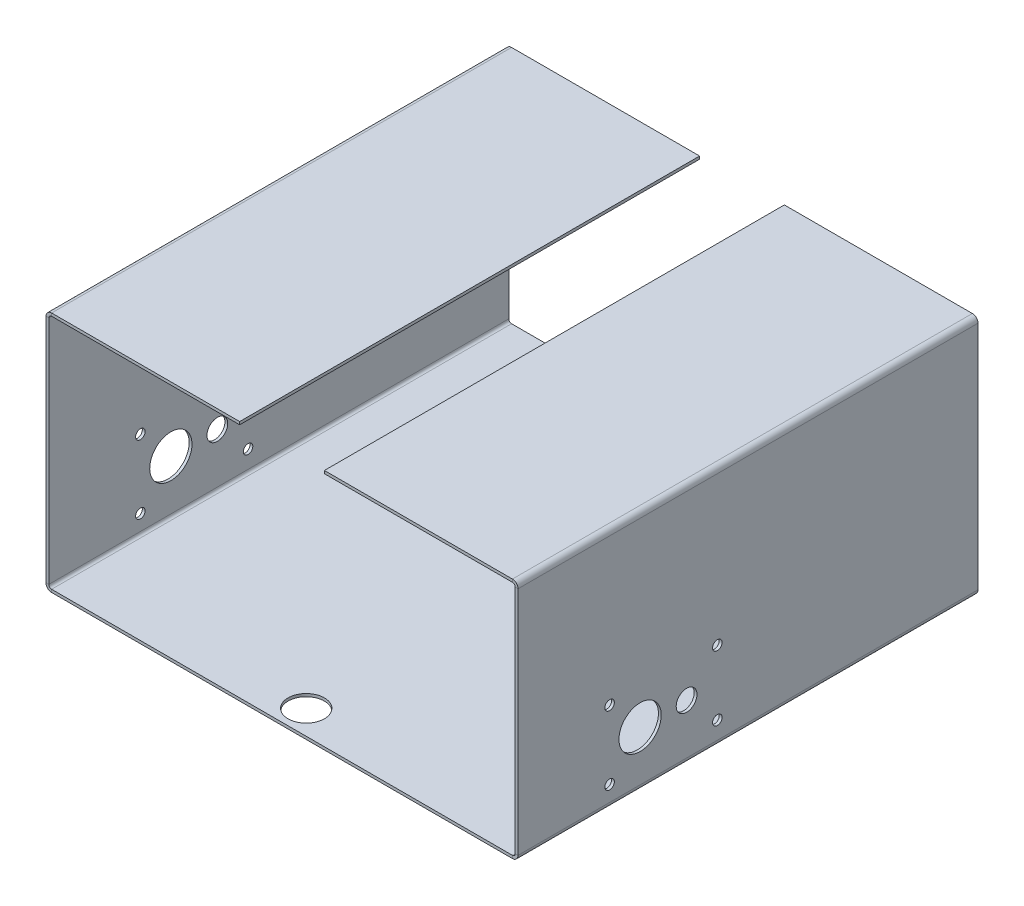
from build123d import *

# Parameters (mm, degrees)
SKETCH1_W                      = 123.825
SKETCH1_H                      = 120.65
BASE_FLANGE1_DEPTH             = 0.7366
EDGE_FLANGE1_STRIP_W           = 4.4196
EDGE_FLANGE1_STRIP_H           = 0.7366
EDGE_FLANGE1_STRIP_CUT_DEPTH   = 120.65
EDGE_FLANGE1_STRIP_2_W         = 4.4196
EDGE_FLANGE1_STRIP_2_H         = 0.7366
EDGE_FLANGE1_STRIP_CUT_2_DEPTH = 120.65
EDGE_FLANGE1_DEPTH             = 120.65
EDGE_FLANGE1_BEND_DEPTH        = 120.65
EDGE_FLANGE2_STRIP_W           = 4.4196
EDGE_FLANGE2_STRIP_H           = 0.7366
EDGE_FLANGE2_STRIP_CUT_DEPTH   = 120.65
EDGE_FLANGE2_DEPTH             = 120.65
EDGE_FLANGE3_STRIP_W           = 4.4196
EDGE_FLANGE3_STRIP_H           = 0.7366
EDGE_FLANGE3_STRIP_CUT_DEPTH   = 120.65
EDGE_FLANGE3_DEPTH             = 120.65
F_4_CLEARANCE_HOLE1_D          = 2.4892
SKETCH28_R                     = 5.54355
SKETCH28_R_2                   = 2.72415
CUT_EXTRUDE1_DEPTH             = 221.859453756
UNFOLD1_OUTLINE_W              = 50.8
UNFOLD1_OUTLINE_H              = 120.65
UNFOLD1_DEPTH                  = 62.7634
UNFOLD1_START                  = -0.7366
UNFOLD1_2_OUTLINE_W            = 162.678345723
UNFOLD1_2_OUTLINE_H            = 120.65
UNFOLD1_2_OUTLINE_R            = 1.2446
UNFOLD1_2_OUTLINE_R_2          = 5.54355
UNFOLD1_2_OUTLINE_R_3          = 2.72415
UNFOLD1_2_DEPTH                = 0.7366
SKETCH30_R                     = 4.7625
CUT_EXTRUDE2_DEPTH             = 1.27
FOLD1_START                    = -111.878345723
FOLD1_OUTLINE_W                = 0.7366
FOLD1_OUTLINE_H                = 120.65
FOLD1_DEPTH                    = 112.029702291
FOLD1_START_2                  = 123.673643432
FOLD1_2_OUTLINE_W              = 0.7366
FOLD1_2_OUTLINE_H              = 120.65
FOLD1_2_DEPTH                  = 112.029702291
FOLD1_START_3                  = 1.4732
FOLD1_3_OUTLINE_W              = 0.7366
FOLD1_3_OUTLINE_H              = 120.65
FOLD1_3_DEPTH                  = 49.3268
FOLD1_START_4                  = 73.025
FOLD1_4_OUTLINE_W              = 0.7366
FOLD1_4_OUTLINE_H              = 120.65
FOLD1_4_DEPTH                  = 49.3268
FOLD1_START_5                  = 0.732563432
FOLD1_5_OUTLINE_W              = 62.0268
FOLD1_5_OUTLINE_H              = 120.65
FOLD1_5_OUTLINE_R              = 1.2446
FOLD1_5_OUTLINE_R_2            = 2.72415
FOLD1_5_OUTLINE_R_3            = 5.54355
FOLD1_5_DEPTH                  = 0.004036568
FOLD1_START_6                  = 123.0884
FOLD1_6_OUTLINE_W              = 62.0268
FOLD1_6_OUTLINE_H              = 120.65
FOLD1_6_OUTLINE_R              = 1.2446
FOLD1_6_OUTLINE_R_2            = 2.72415
FOLD1_6_OUTLINE_R_3            = 5.54355
FOLD1_6_DEPTH                  = 0.004036568
FOLD1_7_OUTLINE_W              = 62.0268
FOLD1_7_OUTLINE_H              = 120.65
FOLD1_7_OUTLINE_R              = 1.2446
FOLD1_7_OUTLINE_R_2            = 2.72415
FOLD1_7_OUTLINE_R_3            = 5.54355
FOLD1_7_DEPTH                  = 1.4732
FOLD1_START_7                  = 122.3518
FOLD1_8_OUTLINE_W              = 62.0268
FOLD1_8_OUTLINE_H              = 120.65
FOLD1_8_OUTLINE_R              = 1.2446
FOLD1_8_OUTLINE_R_2            = 2.72415
FOLD1_8_OUTLINE_R_3            = 5.54355
FOLD1_8_DEPTH                  = 1.4732
FOLD1_START_8                  = -120.65
FOLD1_9_DEPTH                  = 120.65
FOLD1_10_DEPTH                 = 120.65


with BuildPart() as part:
    # Base-Flange1: sheet metal written as solids
    # Sketch1 → Base-Flange1 (new body)
    with BuildSketch(Plane(origin=(0, 0, 0), x_dir=(1, 0, 0), z_dir=(0, 1, 0))):
        with Locations((61.9125, 60.325)):
            Rectangle(SKETCH1_W, SKETCH1_H)
    extrude(amount=-BASE_FLANGE1_DEPTH)

    # Edge-Flange1: sheet metal written as solids
    # Edge-Flange1 strip (on a plane across the edge) → Edge-Flange1 strip cut (cut)
    with BuildSketch(Plane(origin=(123.825, 0, 0), x_dir=(-1, 0, 0), z_dir=(0, 0, -1))):
        with Locations((-0.7366, -0.3683)):
            Rectangle(EDGE_FLANGE1_STRIP_W, EDGE_FLANGE1_STRIP_H)
    extrude(amount=EDGE_FLANGE1_STRIP_CUT_DEPTH, mode=Mode.SUBTRACT)

    # Edge-Flange1 strip 2 (on a plane across the edge) → Edge-Flange1 strip cut 2 (cut)
    with BuildSketch(Plane.XY.offset(-120.65)):
        with Locations((-0.7366, -0.3683)):
            Rectangle(EDGE_FLANGE1_STRIP_2_W, EDGE_FLANGE1_STRIP_2_H)
    extrude(amount=EDGE_FLANGE1_STRIP_CUT_2_DEPTH, mode=Mode.SUBTRACT)

    # Edge-Flange1 section (on a plane across the edge) → Edge-Flange1 (add)
    with BuildSketch(Plane(origin=(123.825, 0, 0), x_dir=(-1, 0, 0), z_dir=(0, 0, -1))):
        with BuildLine():
            Line((0, 0.7366), (0, 62.7634))
            Line((0, 62.7634), (0.7366, 62.7634))
            Line((0.7366, 62.7634), (0.7366, 0.7366))
            ThreePointArc((0.7366, 0.7366), (0.952345145, 0.215745145), (1.4732, 0))
            Line((1.4732, 0), (1.4732, -0.7366))
            ThreePointArc((1.4732, -0.7366), (0.43149029, -0.30510971), (0, 0.7366))
        make_face()
    extrude(amount=EDGE_FLANGE1_DEPTH)

    # Edge-Flange1 section 2 (on a plane across the edge) → Edge-Flange1 bend (add)
    with BuildSketch(Plane.XY.offset(-120.65)):
        with BuildLine():
            Line((0, 0.7366), (0, 62.7634))
            Line((0, 62.7634), (0.7366, 62.7634))
            Line((0.7366, 62.7634), (0.7366, 0.7366))
            ThreePointArc((0.7366, 0.7366), (0.952345145, 0.215745145), (1.4732, 0))
            Line((1.4732, 0), (1.4732, -0.7366))
            ThreePointArc((1.4732, -0.7366), (0.43149029, -0.30510971), (0, 0.7366))
        make_face()
    extrude(amount=EDGE_FLANGE1_BEND_DEPTH)

    # Edge-Flange2: sheet metal written as solids
    # Edge-Flange2 strip (on a plane across the edge) → Edge-Flange2 strip cut (cut)
    with BuildSketch(Plane(origin=(123.0884, 62.7634, 0), x_dir=(0, -1, 0), z_dir=(0, 0, -1))):
        with Locations((-0.7366, -0.3683)):
            Rectangle(EDGE_FLANGE2_STRIP_W, EDGE_FLANGE2_STRIP_H)
    extrude(amount=EDGE_FLANGE2_STRIP_CUT_DEPTH, mode=Mode.SUBTRACT)

    # Edge-Flange2 section (on a plane across the edge) → Edge-Flange2 (add)
    with BuildSketch(Plane(origin=(123.0884, 62.7634, 0), x_dir=(0, -1, 0), z_dir=(0, 0, -1))):
        with BuildLine():
            Line((0, 0.7366), (0, 50.0634))
            Line((0, 50.0634), (0.7366, 50.0634))
            Line((0.7366, 50.0634), (0.7366, 0.7366))
            ThreePointArc((0.7366, 0.7366), (0.952345145, 0.215745145), (1.4732, 0))
            Line((1.4732, 0), (1.4732, -0.7366))
            ThreePointArc((1.4732, -0.7366), (0.43149029, -0.30510971), (0, 0.7366))
        make_face()
    extrude(amount=EDGE_FLANGE2_DEPTH)

    # Edge-Flange3: sheet metal written as solids
    # Edge-Flange3 strip (on a plane across the edge) → Edge-Flange3 strip cut (cut)
    with BuildSketch(Plane(origin=(0.7366, 62.7634, -120.65), x_dir=(0, -1, 0), z_dir=(0, 0, 1))):
        with Locations((-0.7366, -0.3683)):
            Rectangle(EDGE_FLANGE3_STRIP_W, EDGE_FLANGE3_STRIP_H)
    extrude(amount=EDGE_FLANGE3_STRIP_CUT_DEPTH, mode=Mode.SUBTRACT)

    # Edge-Flange3 section (on a plane across the edge) → Edge-Flange3 (add)
    with BuildSketch(Plane(origin=(0.7366, 62.7634, -120.65), x_dir=(0, -1, 0), z_dir=(0, 0, 1))):
        with BuildLine():
            Line((0, 0.7366), (0, 50.0634))
            Line((0, 50.0634), (0.7366, 50.0634))
            Line((0.7366, 50.0634), (0.7366, 0.7366))
            ThreePointArc((0.7366, 0.7366), (0.952345145, 0.215745145), (1.4732, 0))
            Line((1.4732, 0), (1.4732, -0.7366))
            ThreePointArc((1.4732, -0.7366), (0.43149029, -0.30510971), (0, 0.7366))
        make_face()
    extrude(amount=EDGE_FLANGE3_DEPTH)

    # #4 Clearance Hole1 (through all)
    with Locations(Plane(origin=(123.825, -24.718066827, -160.602803993), x_dir=(0, 0, -1), z_dir=(1, 0, 0))):
        with Locations((-136.587103993, 47.560286827), (-136.587103993, 29.561846827), (-108.337223993, 47.061176827), (-108.337223993, 30.060956827)):
            Hole(F_4_CLEARANCE_HOLE1_D / 2)

    # Sketch28 → Cut-Extrude1 (cut, through all)
    with BuildSketch(Plane(origin=(123.825, -24.718066827, -160.602803993), x_dir=(0, 0, -1), z_dir=(1, 0, 0))):
        with Locations(Location((-128.588643993, 38.561066827, 0), (0, 0, 90))):
            Circle(SKETCH28_R)
        with Locations(Location((-116.391563993, 38.561066827, 0), (0, 0, 90))):
            Circle(SKETCH28_R_2)
    extrude(amount=-CUT_EXTRUDE1_DEPTH, mode=Mode.SUBTRACT)

    # Unfold1: read off the stored shape, not the designer's step
    # Unfold1 outline → Unfold1 (cut)
    with BuildSketch(Plane(origin=(0, 0, 0), x_dir=(1, 0, 0), z_dir=(0, 1, 0))):
        with Locations((25.4, 60.325)):
            Rectangle(UNFOLD1_OUTLINE_W, UNFOLD1_OUTLINE_H)
        with Locations((98.425, 60.325)):
            Rectangle(UNFOLD1_OUTLINE_W, UNFOLD1_OUTLINE_H)
    extrude(amount=UNFOLD1_DEPTH, mode=Mode.SUBTRACT)

    # Unfold1 2 outline → Unfold1 2 (add)
    # profile 1 of 2: a face of its own
    with BuildSketch(Plane(origin=(0, 0, 0), x_dir=(1, 0, 0), z_dir=(0, 1, 0)).offset(UNFOLD1_START)):
        with Locations((-30.539172862, 60.325)):
            Rectangle(UNFOLD1_2_OUTLINE_W, UNFOLD1_2_OUTLINE_H)
        with Locations((-22.367992861, 24.0157)):
            Circle(UNFOLD1_2_OUTLINE_R, mode=Mode.SUBTRACT)
        with Locations((-4.369552861, 24.0157)):
            Circle(UNFOLD1_2_OUTLINE_R, mode=Mode.SUBTRACT)
        with Locations((-13.368772861, 32.01416)):
            Circle(UNFOLD1_2_OUTLINE_R_2, mode=Mode.SUBTRACT)
        with Locations((-13.368772861, 44.21124)):
            Circle(UNFOLD1_2_OUTLINE_R_3, mode=Mode.SUBTRACT)
        with Locations((-21.868882861, 52.26558)):
            Circle(UNFOLD1_2_OUTLINE_R, mode=Mode.SUBTRACT)
        with Locations((-4.868662861, 52.26558)):
            Circle(UNFOLD1_2_OUTLINE_R, mode=Mode.SUBTRACT)
    # profile 2 of 2: a face of its own
    with BuildSketch(Plane(origin=(0, 0, 0), x_dir=(1, 0, 0), z_dir=(0, 1, 0)).offset(UNFOLD1_START)):
        with Locations((154.364172862, 60.325)):
            Rectangle(UNFOLD1_2_OUTLINE_W, UNFOLD1_2_OUTLINE_H)
        with Locations((145.693882861, 52.26558)):
            Circle(UNFOLD1_2_OUTLINE_R, mode=Mode.SUBTRACT)
        with Locations((128.194552861, 24.0157)):
            Circle(UNFOLD1_2_OUTLINE_R, mode=Mode.SUBTRACT)
        with Locations((146.192992861, 24.0157)):
            Circle(UNFOLD1_2_OUTLINE_R, mode=Mode.SUBTRACT)
        with Locations((137.193772861, 32.01416)):
            Circle(UNFOLD1_2_OUTLINE_R_2, mode=Mode.SUBTRACT)
        with Locations((137.193772861, 44.21124)):
            Circle(UNFOLD1_2_OUTLINE_R_3, mode=Mode.SUBTRACT)
        with Locations((128.693662861, 52.26558)):
            Circle(UNFOLD1_2_OUTLINE_R, mode=Mode.SUBTRACT)
    extrude(amount=UNFOLD1_2_DEPTH)

    # Sketch30 → Cut-Extrude2 (cut)
    with BuildSketch(Plane(origin=(0, 0, 0), x_dir=(1, 0, 0), z_dir=(0, 1, 0))):
        with Locations(Location((61.9125, 114.3, 0), (0, 0, 270))):
            Circle(SKETCH30_R)
        with Locations(Location((61.9125, 6.35, 0), (0, 0, 270))):
            Circle(SKETCH30_R)
    extrude(amount=-CUT_EXTRUDE2_DEPTH, mode=Mode.SUBTRACT)

    # Fold1: read off the stored shape, not the designer's step
    # Fold1 outline → Fold1 (cut)
    with BuildSketch(Plane.YZ.offset(FOLD1_START)):
        with Locations((-0.3683, -60.325)):
            Rectangle(FOLD1_OUTLINE_W, FOLD1_OUTLINE_H)
    extrude(amount=FOLD1_DEPTH, mode=Mode.SUBTRACT)

    # Fold1 2 outline → Fold1 2 (cut)
    with BuildSketch(Plane.YZ.offset(FOLD1_START_2)):
        with Locations((-0.3683, -60.325)):
            Rectangle(FOLD1_2_OUTLINE_W, FOLD1_2_OUTLINE_H)
    extrude(amount=FOLD1_2_DEPTH, mode=Mode.SUBTRACT)

    # Fold1 5 outline → Fold1 5 (add)
    with BuildSketch(Plane.YZ.offset(FOLD1_START_5)):
        with Locations((31.0134, -60.325)):
            Rectangle(FOLD1_5_OUTLINE_W, FOLD1_5_OUTLINE_H)
        with Locations((5.34289, -52.26558)):
            Circle(FOLD1_5_OUTLINE_R, mode=Mode.SUBTRACT)
        with Locations((13.843, -44.21124)):
            Circle(FOLD1_5_OUTLINE_R_2, mode=Mode.SUBTRACT)
        with Locations((13.843, -32.01416)):
            Circle(FOLD1_5_OUTLINE_R_3, mode=Mode.SUBTRACT)
        with Locations((22.34311, -52.26558)):
            Circle(FOLD1_5_OUTLINE_R, mode=Mode.SUBTRACT)
        with Locations((4.84378, -24.0157)):
            Circle(FOLD1_5_OUTLINE_R, mode=Mode.SUBTRACT)
        with Locations((22.84222, -24.0157)):
            Circle(FOLD1_5_OUTLINE_R, mode=Mode.SUBTRACT)
    extrude(amount=FOLD1_5_DEPTH)

    # Fold1 6 outline → Fold1 6 (add)
    with BuildSketch(Plane.YZ.offset(FOLD1_START_6)):
        with Locations((31.0134, -60.325)):
            Rectangle(FOLD1_6_OUTLINE_W, FOLD1_6_OUTLINE_H)
        with Locations((5.34289, -52.26558)):
            Circle(FOLD1_6_OUTLINE_R, mode=Mode.SUBTRACT)
        with Locations((13.843, -44.21124)):
            Circle(FOLD1_6_OUTLINE_R_2, mode=Mode.SUBTRACT)
        with Locations((13.843, -32.01416)):
            Circle(FOLD1_6_OUTLINE_R_3, mode=Mode.SUBTRACT)
        with Locations((22.34311, -52.26558)):
            Circle(FOLD1_6_OUTLINE_R, mode=Mode.SUBTRACT)
        with Locations((4.84378, -24.0157)):
            Circle(FOLD1_6_OUTLINE_R, mode=Mode.SUBTRACT)
        with Locations((22.84222, -24.0157)):
            Circle(FOLD1_6_OUTLINE_R, mode=Mode.SUBTRACT)
    extrude(amount=FOLD1_6_DEPTH)



with BuildPart() as body_2:
    # Fold1 3 outline → Fold1 3 (new body)
    with BuildSketch(Plane.YZ.offset(FOLD1_START_3)):
        with Locations((62.3951, -60.325)):
            Rectangle(FOLD1_3_OUTLINE_W, FOLD1_3_OUTLINE_H)
    extrude(amount=FOLD1_3_DEPTH)


with BuildPart() as body_3:
    # Fold1 4 outline → Fold1 4 (new body)
    with BuildSketch(Plane.YZ.offset(FOLD1_START_4)):
        with Locations((62.3951, -60.325)):
            Rectangle(FOLD1_4_OUTLINE_W, FOLD1_4_OUTLINE_H)
    extrude(amount=FOLD1_4_DEPTH)


with BuildPart() as part_1:
    add(part.part)

    add(body_2.part)  # Fold1 7 merges body 2
    # Fold1 7 outline → Fold1 7 (add)
    with BuildSketch(Plane.YZ):
        with Locations((31.0134, -60.325)):
            Rectangle(FOLD1_7_OUTLINE_W, FOLD1_7_OUTLINE_H)
        with Locations((5.34289, -52.26558)):
            Circle(FOLD1_7_OUTLINE_R, mode=Mode.SUBTRACT)
        with Locations((13.843, -44.21124)):
            Circle(FOLD1_7_OUTLINE_R_2, mode=Mode.SUBTRACT)
        with Locations((13.843, -32.01416)):
            Circle(FOLD1_7_OUTLINE_R_3, mode=Mode.SUBTRACT)
        with Locations((22.34311, -52.26558)):
            Circle(FOLD1_7_OUTLINE_R, mode=Mode.SUBTRACT)
        with Locations((4.84378, -24.0157)):
            Circle(FOLD1_7_OUTLINE_R, mode=Mode.SUBTRACT)
        with Locations((22.84222, -24.0157)):
            Circle(FOLD1_7_OUTLINE_R, mode=Mode.SUBTRACT)
    extrude(amount=FOLD1_7_DEPTH)


    add(body_3.part)  # Fold1 8 merges body 3
    # Fold1 8 outline → Fold1 8 (add)
    with BuildSketch(Plane.YZ.offset(FOLD1_START_7)):
        with Locations((31.0134, -60.325)):
            Rectangle(FOLD1_8_OUTLINE_W, FOLD1_8_OUTLINE_H)
        with Locations((5.34289, -52.26558)):
            Circle(FOLD1_8_OUTLINE_R, mode=Mode.SUBTRACT)
        with Locations((13.843, -44.21124)):
            Circle(FOLD1_8_OUTLINE_R_2, mode=Mode.SUBTRACT)
        with Locations((13.843, -32.01416)):
            Circle(FOLD1_8_OUTLINE_R_3, mode=Mode.SUBTRACT)
        with Locations((22.34311, -52.26558)):
            Circle(FOLD1_8_OUTLINE_R, mode=Mode.SUBTRACT)
        with Locations((4.84378, -24.0157)):
            Circle(FOLD1_8_OUTLINE_R, mode=Mode.SUBTRACT)
        with Locations((22.84222, -24.0157)):
            Circle(FOLD1_8_OUTLINE_R, mode=Mode.SUBTRACT)
    extrude(amount=FOLD1_8_DEPTH)

    # Fold1 9 outline → Fold1 9 (cut)
    with BuildSketch(Plane.XY.offset(FOLD1_START_8)):
        with BuildLine():
            Line((0.151356568, -0.7366), (1.4732, -0.7366))
            ThreePointArc((1.4732, -0.7366), (0.43149029, -0.30510971), (0, 0.7366))
            Line((0, 0.7366), (0, 0))
            Line((0, 0), (0.151356568, 0))
            Line((0.151356568, 0), (0.151356568, -0.7366))
        make_face()
        with BuildLine():
            ThreePointArc((123.0884, 61.2902), (122.872654855, 61.811054855), (122.3518, 62.0268))
            Line((122.3518, 62.0268), (122.3518, 0))
            ThreePointArc((122.3518, 0), (122.872654855, 0.215745145), (123.0884, 0.7366))
            Line((123.0884, 0.7366), (123.0884, 61.2902))
        make_face()
        with BuildLine():
            ThreePointArc((123.627628625, 62.0268), (123.774801927, 61.671492217), (123.825, 61.2902))
            Line((123.825, 61.2902), (123.825, 62.0268))
            Line((123.825, 62.0268), (123.627628625, 62.0268))
        make_face()
        with BuildLine():
            ThreePointArc((123.825, 0.7366), (123.39350971, -0.30510971), (122.3518, -0.7366))
            Line((122.3518, -0.7366), (123.673643432, -0.7366))
            Line((123.673643432, -0.7366), (123.673643432, 0))
            Line((123.673643432, 0), (123.825, 0))
            Line((123.825, 0), (123.825, 0.7366))
        make_face()
        with BuildLine():
            Line((1.4732, 0), (1.4732, 62.0268))
            ThreePointArc((1.4732, 62.0268), (0.952345145, 61.811054855), (0.7366, 61.2902))
            Line((0.7366, 61.2902), (0.7366, 0.7366))
            ThreePointArc((0.7366, 0.7366), (0.952345145, 0.215745145), (1.4732, 0))
        make_face()
        with BuildLine():
            Line((0, 62.0268), (0, 61.2902))
            ThreePointArc((0, 61.2902), (0.050198073, 61.671492217), (0.197371375, 62.0268))
            Line((0.197371375, 62.0268), (0, 62.0268))
        make_face()
    extrude(amount=FOLD1_9_DEPTH, mode=Mode.SUBTRACT)

    # Fold1 10 outline → Fold1 10 (add)
    with BuildSketch(Plane.XY.offset(FOLD1_START_8)):
        with BuildLine():
            Line((122.3518, 62.0268), (123.627628625, 62.0268))
            ThreePointArc((123.627628625, 62.0268), (123.0884, 62.566028625), (122.3518, 62.7634))
            Line((122.3518, 62.7634), (122.3518, 62.0268))
        make_face()
        with BuildLine():
            ThreePointArc((1.4732, 62.7634), (0.7366, 62.566028625), (0.197371375, 62.0268))
            Line((0.197371375, 62.0268), (1.4732, 62.0268))
            Line((1.4732, 62.0268), (1.4732, 62.7634))
        make_face()
    extrude(amount=FOLD1_10_DEPTH)


solid = part_1.part
